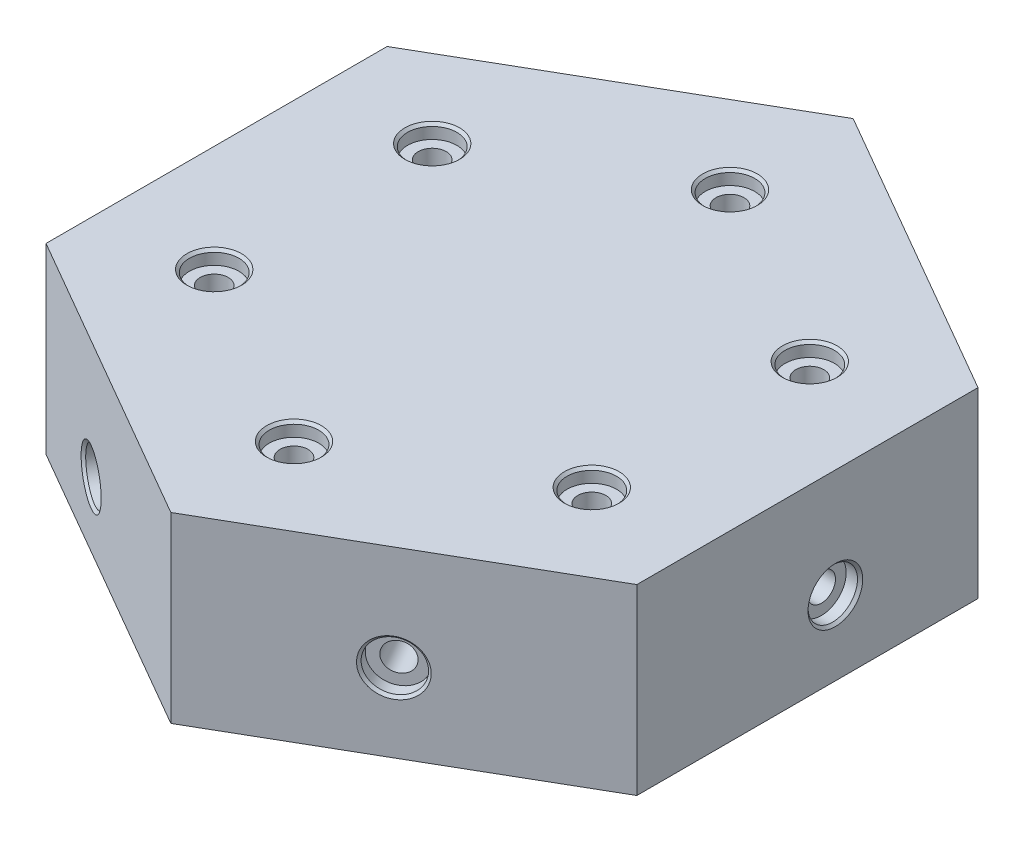
from build123d import *
from OCP.BRepAlgoAPI import BRepAlgoAPI_Cut
from OCP.TopTools import TopTools_ListOfShape

# Parameters (mm, degrees)
BOSS_EXTRUDE1_DEPTH = 44


with BuildPart() as part:
    # Sketch1 → Boss-Extrude1 (new body)
    with BuildSketch(Plane(origin=(0, 0, 0), x_dir=(1, 0, 0), z_dir=(0, 1, 0))):
        Polygon((0, 82.155292998), (-71.148570791, 41.077646499), (-71.148570791, -41.077646499), (0, -82.155292998), (71.148570791, -41.077646499), (71.148570791, 41.077646499), align=None)
    extrude(amount=BOSS_EXTRUDE1_DEPTH)


with BuildPart() as cbore_for_1_4_button_head_cap_screw1_tool:
    # Sketch2 → CBORE for 1/4 Button Head Cap Screw1 (revolve)
    with BuildSketch(Plane(origin=(71.148570791, 17.91492161, -6.728449567), x_dir=(0, 0, -1), z_dir=(0, 1, 0))):
        Polygon((0, 0), (0, 27.029827343), (3.3782, 25), (3.3782, 3.3528), (5.95376, 3.3528), (5.95376, 0.635), (6.58876, 0), align=None)
    revolve(axis=Axis((77.498570791, 17.91492161, -6.728449567), (-1, 0, 0)))


with BuildPart() as part_1:
    add(part.part)

    # CBORE for 1/4 Button Head Cap Screw1: cut by cbore_for_1_4_button_head_cap_screw1_tool, with a tolerance
    cbore_for_1_4_button_head_cap_screw1_stock = TopTools_ListOfShape()
    cbore_for_1_4_button_head_cap_screw1_stock.Append(part_1.part.wrapped)
    cbore_for_1_4_button_head_cap_screw1_tools = TopTools_ListOfShape()
    cbore_for_1_4_button_head_cap_screw1_tools.Append(cbore_for_1_4_button_head_cap_screw1_tool.part.wrapped)
    cbore_for_1_4_button_head_cap_screw1_cut = BRepAlgoAPI_Cut()
    cbore_for_1_4_button_head_cap_screw1_cut.SetArguments(cbore_for_1_4_button_head_cap_screw1_stock)
    cbore_for_1_4_button_head_cap_screw1_cut.SetTools(cbore_for_1_4_button_head_cap_screw1_tools)
    cbore_for_1_4_button_head_cap_screw1_cut.SetFuzzyValue(0.00001)
    cbore_for_1_4_button_head_cap_screw1_cut.Build()
    add(Compound.cast(cbore_for_1_4_button_head_cap_screw1_cut.Shape()).solids(), mode=Mode.REPLACE)


with BuildPart() as cbore_for_1_4_button_head_cap_screw1_at_tool:
    # Sketch2 at point 2 (carried to point 2, square into its face) → CBORE for 1/4 Button Head Cap Screw1 at (revolve)
    with BuildSketch(Plane(origin=(34.047996554, 18.811739105, 62.497673022), x_dir=(0.866025303, 0, -0.500000175), z_dir=(0, 1, 0))):
        Polygon((0, 0), (0, 27.029827343), (3.3782, 25), (3.3782, 3.3528), (5.95376, 3.3528), (5.95376, 0.635), (6.58876, 0), align=None)
    revolve(axis=Axis((37.222997664, 18.811739105, 67.996933695), (-0.500000175, 0, -0.866025303)))


with BuildPart() as part_2:
    add(part_1.part)

    # CBORE for 1/4 Button Head Cap Screw1 at: cut by cbore_for_1_4_button_head_cap_screw1_at_tool, with a tolerance
    cbore_for_1_4_button_head_cap_screw1_at_stock = TopTools_ListOfShape()
    cbore_for_1_4_button_head_cap_screw1_at_stock.Append(part_2.part.wrapped)
    cbore_for_1_4_button_head_cap_screw1_at_tools = TopTools_ListOfShape()
    cbore_for_1_4_button_head_cap_screw1_at_tools.Append(cbore_for_1_4_button_head_cap_screw1_at_tool.part.wrapped)
    cbore_for_1_4_button_head_cap_screw1_at_cut = BRepAlgoAPI_Cut()
    cbore_for_1_4_button_head_cap_screw1_at_cut.SetArguments(cbore_for_1_4_button_head_cap_screw1_at_stock)
    cbore_for_1_4_button_head_cap_screw1_at_cut.SetTools(cbore_for_1_4_button_head_cap_screw1_at_tools)
    cbore_for_1_4_button_head_cap_screw1_at_cut.SetFuzzyValue(0.00001)
    cbore_for_1_4_button_head_cap_screw1_at_cut.Build()
    add(Compound.cast(cbore_for_1_4_button_head_cap_screw1_at_cut.Shape()).solids(), mode=Mode.REPLACE)


with BuildPart() as cbore_for_1_4_button_head_cap_screw1_2_tool:
    # Sketch2 at point 3 (carried to point 3, square into its face) → CBORE for 1_4 Button Head Cap Screw1 2 (revolve)
    with BuildSketch(Plane(origin=(-45.42290748, 15.582909189, 55.930365137), x_dir=(0.866025303, 0, 0.500000175), z_dir=(0, 1, 0))):
        Polygon((0, 0), (0, 27.029827343), (3.3782, 25), (3.3782, 3.3528), (5.95376, 3.3528), (5.95376, 0.635), (6.58876, 0), align=None)
    revolve(axis=Axis((-48.59790859, 15.582909189, 61.42962581), (0.500000175, 0, -0.866025303)))


with BuildPart() as part_3:
    add(part_2.part)

    # CBORE for 1_4 Button Head Cap Screw1 2: cut by cbore_for_1_4_button_head_cap_screw1_2_tool, with a tolerance
    cbore_for_1_4_button_head_cap_screw1_2_stock = TopTools_ListOfShape()
    cbore_for_1_4_button_head_cap_screw1_2_stock.Append(part_3.part.wrapped)
    cbore_for_1_4_button_head_cap_screw1_2_tools = TopTools_ListOfShape()
    cbore_for_1_4_button_head_cap_screw1_2_tools.Append(cbore_for_1_4_button_head_cap_screw1_2_tool.part.wrapped)
    cbore_for_1_4_button_head_cap_screw1_2_cut = BRepAlgoAPI_Cut()
    cbore_for_1_4_button_head_cap_screw1_2_cut.SetArguments(cbore_for_1_4_button_head_cap_screw1_2_stock)
    cbore_for_1_4_button_head_cap_screw1_2_cut.SetTools(cbore_for_1_4_button_head_cap_screw1_2_tools)
    cbore_for_1_4_button_head_cap_screw1_2_cut.SetFuzzyValue(0.00001)
    cbore_for_1_4_button_head_cap_screw1_2_cut.Build()
    add(Compound.cast(cbore_for_1_4_button_head_cap_screw1_2_cut.Shape()).solids(), mode=Mode.REPLACE)


with BuildPart() as cbore_for_1_4_button_head_cap_screw1_3_tool:
    # Sketch2 at point 4 (carried to point 4, square into its face) → CBORE for 1_4 Button Head Cap Screw1 3 (revolve)
    with BuildSketch(Plane(origin=(-71.148570791, 19.685573665, -1.956870484), x_dir=(0, 0, -1), z_dir=(0, -1, 0))):
        Polygon((0, 0), (0, 27.029827343), (3.3782, 25), (3.3782, 3.3528), (5.95376, 3.3528), (5.95376, 0.635), (6.58876, 0), align=None)
    revolve(axis=Axis((-77.498570791, 19.685573665, -1.956870484), (1, 0, 0)))


with BuildPart() as part_4:
    add(part_3.part)

    # CBORE for 1_4 Button Head Cap Screw1 3: cut by cbore_for_1_4_button_head_cap_screw1_3_tool, with a tolerance
    cbore_for_1_4_button_head_cap_screw1_3_stock = TopTools_ListOfShape()
    cbore_for_1_4_button_head_cap_screw1_3_stock.Append(part_4.part.wrapped)
    cbore_for_1_4_button_head_cap_screw1_3_tools = TopTools_ListOfShape()
    cbore_for_1_4_button_head_cap_screw1_3_tools.Append(cbore_for_1_4_button_head_cap_screw1_3_tool.part.wrapped)
    cbore_for_1_4_button_head_cap_screw1_3_cut = BRepAlgoAPI_Cut()
    cbore_for_1_4_button_head_cap_screw1_3_cut.SetArguments(cbore_for_1_4_button_head_cap_screw1_3_stock)
    cbore_for_1_4_button_head_cap_screw1_3_cut.SetTools(cbore_for_1_4_button_head_cap_screw1_3_tools)
    cbore_for_1_4_button_head_cap_screw1_3_cut.SetFuzzyValue(0.00001)
    cbore_for_1_4_button_head_cap_screw1_3_cut.Build()
    add(Compound.cast(cbore_for_1_4_button_head_cap_screw1_3_cut.Shape()).solids(), mode=Mode.REPLACE)


with BuildPart() as cbore_for_1_4_button_head_cap_screw1_4_tool:
    # Sketch2 at point 5 (carried to point 5, square into its face) → CBORE for 1_4 Button Head Cap Screw1 4 (revolve)
    with BuildSketch(Plane(origin=(-38.282678088, 22.263906774, -60.052778498), x_dir=(-0.866025303, 0, 0.500000175), z_dir=(0, 1, 0))):
        Polygon((0, 0), (0, 27.029827343), (3.3782, 25), (3.3782, 3.3528), (5.95376, 3.3528), (5.95376, 0.635), (6.58876, 0), align=None)
    revolve(axis=Axis((-41.457679199, 22.263906774, -65.552039171), (0.500000175, 0, 0.866025303)))


with BuildPart() as part_5:
    add(part_4.part)

    # CBORE for 1_4 Button Head Cap Screw1 4: cut by cbore_for_1_4_button_head_cap_screw1_4_tool, with a tolerance
    cbore_for_1_4_button_head_cap_screw1_4_stock = TopTools_ListOfShape()
    cbore_for_1_4_button_head_cap_screw1_4_stock.Append(part_5.part.wrapped)
    cbore_for_1_4_button_head_cap_screw1_4_tools = TopTools_ListOfShape()
    cbore_for_1_4_button_head_cap_screw1_4_tools.Append(cbore_for_1_4_button_head_cap_screw1_4_tool.part.wrapped)
    cbore_for_1_4_button_head_cap_screw1_4_cut = BRepAlgoAPI_Cut()
    cbore_for_1_4_button_head_cap_screw1_4_cut.SetArguments(cbore_for_1_4_button_head_cap_screw1_4_stock)
    cbore_for_1_4_button_head_cap_screw1_4_cut.SetTools(cbore_for_1_4_button_head_cap_screw1_4_tools)
    cbore_for_1_4_button_head_cap_screw1_4_cut.SetFuzzyValue(0.00001)
    cbore_for_1_4_button_head_cap_screw1_4_cut.Build()
    add(Compound.cast(cbore_for_1_4_button_head_cap_screw1_4_cut.Shape()).solids(), mode=Mode.REPLACE)


with BuildPart() as cbore_for_1_4_button_head_cap_screw1_5_tool:
    # Sketch2 at point 6 (carried to point 6, square into its face) → CBORE for 1_4 Button Head Cap Screw1 5 (revolve)
    with BuildSketch(Plane(origin=(35.574285396, 22, -61.616469748), x_dir=(-0.866025303, 0, -0.500000175), z_dir=(0, 1, 0))):
        Polygon((0, 0), (0, 27.029827343), (3.3782, 25), (3.3782, 3.3528), (5.95376, 3.3528), (5.95376, 0.635), (6.58876, 0), align=None)
    revolve(axis=Axis((38.749286506, 22, -67.115730421), (-0.500000175, 0, 0.866025303)))


with BuildPart() as part_6:
    add(part_5.part)

    # CBORE for 1_4 Button Head Cap Screw1 5: cut by cbore_for_1_4_button_head_cap_screw1_5_tool, with a tolerance
    cbore_for_1_4_button_head_cap_screw1_5_stock = TopTools_ListOfShape()
    cbore_for_1_4_button_head_cap_screw1_5_stock.Append(part_6.part.wrapped)
    cbore_for_1_4_button_head_cap_screw1_5_tools = TopTools_ListOfShape()
    cbore_for_1_4_button_head_cap_screw1_5_tools.Append(cbore_for_1_4_button_head_cap_screw1_5_tool.part.wrapped)
    cbore_for_1_4_button_head_cap_screw1_5_cut = BRepAlgoAPI_Cut()
    cbore_for_1_4_button_head_cap_screw1_5_cut.SetArguments(cbore_for_1_4_button_head_cap_screw1_5_stock)
    cbore_for_1_4_button_head_cap_screw1_5_cut.SetTools(cbore_for_1_4_button_head_cap_screw1_5_tools)
    cbore_for_1_4_button_head_cap_screw1_5_cut.SetFuzzyValue(0.00001)
    cbore_for_1_4_button_head_cap_screw1_5_cut.Build()
    add(Compound.cast(cbore_for_1_4_button_head_cap_screw1_5_cut.Shape()).solids(), mode=Mode.REPLACE)


with BuildPart() as cbore_for_1_4_button_head_cap_screw1_6_tool:
    # Sketch2 at point 7 (carried to point 7, square into its face) → CBORE for 1_4 Button Head Cap Screw1 6 (revolve)
    with BuildSketch(Plane(origin=(-45.466333699, 44, -26.25), x_dir=(0, 0, -1), z_dir=(-1, 0, 0))):
        Polygon((0, 0), (0, 27.029827343), (3.3782, 25), (3.3782, 3.3528), (5.95376, 3.3528), (5.95376, 0.635), (6.58876, 0), align=None)
    revolve(axis=Axis((-45.466333699, 50.35, -26.25), (0, -1, 0)))


with BuildPart() as part_7:
    add(part_6.part)

    # CBORE for 1_4 Button Head Cap Screw1 6: cut by cbore_for_1_4_button_head_cap_screw1_6_tool, with a tolerance
    cbore_for_1_4_button_head_cap_screw1_6_stock = TopTools_ListOfShape()
    cbore_for_1_4_button_head_cap_screw1_6_stock.Append(part_7.part.wrapped)
    cbore_for_1_4_button_head_cap_screw1_6_tools = TopTools_ListOfShape()
    cbore_for_1_4_button_head_cap_screw1_6_tools.Append(cbore_for_1_4_button_head_cap_screw1_6_tool.part.wrapped)
    cbore_for_1_4_button_head_cap_screw1_6_cut = BRepAlgoAPI_Cut()
    cbore_for_1_4_button_head_cap_screw1_6_cut.SetArguments(cbore_for_1_4_button_head_cap_screw1_6_stock)
    cbore_for_1_4_button_head_cap_screw1_6_cut.SetTools(cbore_for_1_4_button_head_cap_screw1_6_tools)
    cbore_for_1_4_button_head_cap_screw1_6_cut.SetFuzzyValue(0.00001)
    cbore_for_1_4_button_head_cap_screw1_6_cut.Build()
    add(Compound.cast(cbore_for_1_4_button_head_cap_screw1_6_cut.Shape()).solids(), mode=Mode.REPLACE)


with BuildPart() as cbore_for_1_4_button_head_cap_screw1_7_tool:
    # Sketch2 at point 8 (carried to point 8, square into its face) → CBORE for 1_4 Button Head Cap Screw1 7 (revolve)
    with BuildSketch(Plane(origin=(0, 44, -52.5), x_dir=(0, 0, -1), z_dir=(-1, 0, 0))):
        Polygon((0, 0), (0, 27.029827343), (3.3782, 25), (3.3782, 3.3528), (5.95376, 3.3528), (5.95376, 0.635), (6.58876, 0), align=None)
    revolve(axis=Axis((0, 50.35, -52.5), (0, -1, 0)))


with BuildPart() as part_8:
    add(part_7.part)

    # CBORE for 1_4 Button Head Cap Screw1 7: cut by cbore_for_1_4_button_head_cap_screw1_7_tool, with a tolerance
    cbore_for_1_4_button_head_cap_screw1_7_stock = TopTools_ListOfShape()
    cbore_for_1_4_button_head_cap_screw1_7_stock.Append(part_8.part.wrapped)
    cbore_for_1_4_button_head_cap_screw1_7_tools = TopTools_ListOfShape()
    cbore_for_1_4_button_head_cap_screw1_7_tools.Append(cbore_for_1_4_button_head_cap_screw1_7_tool.part.wrapped)
    cbore_for_1_4_button_head_cap_screw1_7_cut = BRepAlgoAPI_Cut()
    cbore_for_1_4_button_head_cap_screw1_7_cut.SetArguments(cbore_for_1_4_button_head_cap_screw1_7_stock)
    cbore_for_1_4_button_head_cap_screw1_7_cut.SetTools(cbore_for_1_4_button_head_cap_screw1_7_tools)
    cbore_for_1_4_button_head_cap_screw1_7_cut.SetFuzzyValue(0.00001)
    cbore_for_1_4_button_head_cap_screw1_7_cut.Build()
    add(Compound.cast(cbore_for_1_4_button_head_cap_screw1_7_cut.Shape()).solids(), mode=Mode.REPLACE)


with BuildPart() as cbore_for_1_4_button_head_cap_screw1_8_tool:
    # Sketch2 at point 9 (carried to point 9, square into its face) → CBORE for 1_4 Button Head Cap Screw1 8 (revolve)
    with BuildSketch(Plane(origin=(45.466333699, 44, -26.25), x_dir=(0, 0, -1), z_dir=(-1, 0, 0))):
        Polygon((0, 0), (0, 27.029827343), (3.3782, 25), (3.3782, 3.3528), (5.95376, 3.3528), (5.95376, 0.635), (6.58876, 0), align=None)
    revolve(axis=Axis((45.466333699, 50.35, -26.25), (0, -1, 0)))


with BuildPart() as part_9:
    add(part_8.part)

    # CBORE for 1_4 Button Head Cap Screw1 8: cut by cbore_for_1_4_button_head_cap_screw1_8_tool, with a tolerance
    cbore_for_1_4_button_head_cap_screw1_8_stock = TopTools_ListOfShape()
    cbore_for_1_4_button_head_cap_screw1_8_stock.Append(part_9.part.wrapped)
    cbore_for_1_4_button_head_cap_screw1_8_tools = TopTools_ListOfShape()
    cbore_for_1_4_button_head_cap_screw1_8_tools.Append(cbore_for_1_4_button_head_cap_screw1_8_tool.part.wrapped)
    cbore_for_1_4_button_head_cap_screw1_8_cut = BRepAlgoAPI_Cut()
    cbore_for_1_4_button_head_cap_screw1_8_cut.SetArguments(cbore_for_1_4_button_head_cap_screw1_8_stock)
    cbore_for_1_4_button_head_cap_screw1_8_cut.SetTools(cbore_for_1_4_button_head_cap_screw1_8_tools)
    cbore_for_1_4_button_head_cap_screw1_8_cut.SetFuzzyValue(0.00001)
    cbore_for_1_4_button_head_cap_screw1_8_cut.Build()
    add(Compound.cast(cbore_for_1_4_button_head_cap_screw1_8_cut.Shape()).solids(), mode=Mode.REPLACE)


with BuildPart() as cbore_for_1_4_button_head_cap_screw1_9_tool:
    # Sketch2 at point 10 (carried to point 10, square into its face) → CBORE for 1_4 Button Head Cap Screw1 9 (revolve)
    with BuildSketch(Plane(origin=(45.466333699, 44, 26.25), x_dir=(0, 0, -1), z_dir=(-1, 0, 0))):
        Polygon((0, 0), (0, 27.029827343), (3.3782, 25), (3.3782, 3.3528), (5.95376, 3.3528), (5.95376, 0.635), (6.58876, 0), align=None)
    revolve(axis=Axis((45.466333699, 50.35, 26.25), (0, -1, 0)))


with BuildPart() as part_10:
    add(part_9.part)

    # CBORE for 1_4 Button Head Cap Screw1 9: cut by cbore_for_1_4_button_head_cap_screw1_9_tool, with a tolerance
    cbore_for_1_4_button_head_cap_screw1_9_stock = TopTools_ListOfShape()
    cbore_for_1_4_button_head_cap_screw1_9_stock.Append(part_10.part.wrapped)
    cbore_for_1_4_button_head_cap_screw1_9_tools = TopTools_ListOfShape()
    cbore_for_1_4_button_head_cap_screw1_9_tools.Append(cbore_for_1_4_button_head_cap_screw1_9_tool.part.wrapped)
    cbore_for_1_4_button_head_cap_screw1_9_cut = BRepAlgoAPI_Cut()
    cbore_for_1_4_button_head_cap_screw1_9_cut.SetArguments(cbore_for_1_4_button_head_cap_screw1_9_stock)
    cbore_for_1_4_button_head_cap_screw1_9_cut.SetTools(cbore_for_1_4_button_head_cap_screw1_9_tools)
    cbore_for_1_4_button_head_cap_screw1_9_cut.SetFuzzyValue(0.00001)
    cbore_for_1_4_button_head_cap_screw1_9_cut.Build()
    add(Compound.cast(cbore_for_1_4_button_head_cap_screw1_9_cut.Shape()).solids(), mode=Mode.REPLACE)


with BuildPart() as cbore_for_1_4_button_head_cap_screw1_10_tool:
    # Sketch2 at point 11 (carried to point 11, square into its face) → CBORE for 1_4 Button Head Cap Screw1 10 (revolve)
    with BuildSketch(Plane(origin=(0, 44, 52.5), x_dir=(0, 0, -1), z_dir=(-1, 0, 0))):
        Polygon((0, 0), (0, 27.029827343), (3.3782, 25), (3.3782, 3.3528), (5.95376, 3.3528), (5.95376, 0.635), (6.58876, 0), align=None)
    revolve(axis=Axis((0, 50.35, 52.5), (0, -1, 0)))


with BuildPart() as part_11:
    add(part_10.part)

    # CBORE for 1_4 Button Head Cap Screw1 10: cut by cbore_for_1_4_button_head_cap_screw1_10_tool, with a tolerance
    cbore_for_1_4_button_head_cap_screw1_10_stock = TopTools_ListOfShape()
    cbore_for_1_4_button_head_cap_screw1_10_stock.Append(part_11.part.wrapped)
    cbore_for_1_4_button_head_cap_screw1_10_tools = TopTools_ListOfShape()
    cbore_for_1_4_button_head_cap_screw1_10_tools.Append(cbore_for_1_4_button_head_cap_screw1_10_tool.part.wrapped)
    cbore_for_1_4_button_head_cap_screw1_10_cut = BRepAlgoAPI_Cut()
    cbore_for_1_4_button_head_cap_screw1_10_cut.SetArguments(cbore_for_1_4_button_head_cap_screw1_10_stock)
    cbore_for_1_4_button_head_cap_screw1_10_cut.SetTools(cbore_for_1_4_button_head_cap_screw1_10_tools)
    cbore_for_1_4_button_head_cap_screw1_10_cut.SetFuzzyValue(0.00001)
    cbore_for_1_4_button_head_cap_screw1_10_cut.Build()
    add(Compound.cast(cbore_for_1_4_button_head_cap_screw1_10_cut.Shape()).solids(), mode=Mode.REPLACE)


with BuildPart() as cbore_for_1_4_button_head_cap_screw1_11_tool:
    # Sketch2 at point 12 (carried to point 12, square into its face) → CBORE for 1_4 Button Head Cap Screw1 11 (revolve)
    with BuildSketch(Plane(origin=(-45.466333699, 44, 26.25), x_dir=(0, 0, -1), z_dir=(-1, 0, 0))):
        Polygon((0, 0), (0, 27.029827343), (3.3782, 25), (3.3782, 3.3528), (5.95376, 3.3528), (5.95376, 0.635), (6.58876, 0), align=None)
    revolve(axis=Axis((-45.466333699, 50.35, 26.25), (0, -1, 0)))


with BuildPart() as part_12:
    add(part_11.part)

    # CBORE for 1_4 Button Head Cap Screw1 11: cut by cbore_for_1_4_button_head_cap_screw1_11_tool, with a tolerance
    cbore_for_1_4_button_head_cap_screw1_11_stock = TopTools_ListOfShape()
    cbore_for_1_4_button_head_cap_screw1_11_stock.Append(part_12.part.wrapped)
    cbore_for_1_4_button_head_cap_screw1_11_tools = TopTools_ListOfShape()
    cbore_for_1_4_button_head_cap_screw1_11_tools.Append(cbore_for_1_4_button_head_cap_screw1_11_tool.part.wrapped)
    cbore_for_1_4_button_head_cap_screw1_11_cut = BRepAlgoAPI_Cut()
    cbore_for_1_4_button_head_cap_screw1_11_cut.SetArguments(cbore_for_1_4_button_head_cap_screw1_11_stock)
    cbore_for_1_4_button_head_cap_screw1_11_cut.SetTools(cbore_for_1_4_button_head_cap_screw1_11_tools)
    cbore_for_1_4_button_head_cap_screw1_11_cut.SetFuzzyValue(0.00001)
    cbore_for_1_4_button_head_cap_screw1_11_cut.Build()
    add(Compound.cast(cbore_for_1_4_button_head_cap_screw1_11_cut.Shape()).solids(), mode=Mode.REPLACE)


solid = part_12.part
